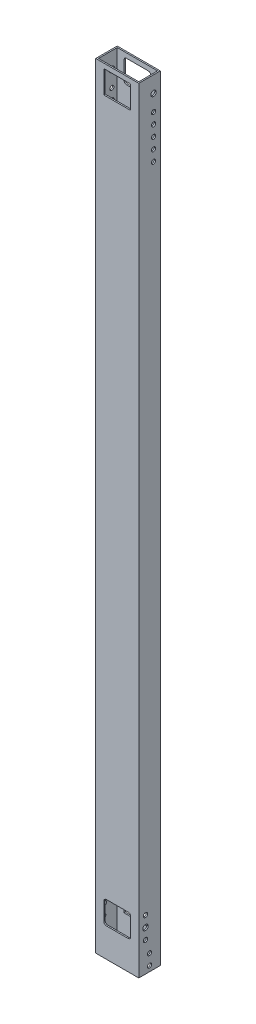
from build123d import *

# Parameters (mm, degrees)
SKETCH1_W               = 50.8
SKETCH1_H               = 914.4
BOSS_EXTRUDE1_DEPTH     = 12.7
SHELL1_T                = -1.5875
CUT_EXTRUDE1_DEPTH      = 459.081095441
CUT_EXTRUDE1_DEPTH_BACK = 459.081095441
SKETCH3_R               = 2.4892
CUT_EXTRUDE2_DEPTH      = 459.081095441
CUT_EXTRUDE2_DEPTH_BACK = 459.081095441
SKETCH4_R               = 3.175
SKETCH4_R_2             = 2.4892
CUT_EXTRUDE3_DEPTH      = 459.081095441
CUT_EXTRUDE3_DEPTH_BACK = 459.081095441
SKETCH5_W               = 31.75
SKETCH5_H               = 26.9875
FILLET1_R               = 3.175
CUT_EXTRUDE4_DEPTH      = 459.081095441
CUT_EXTRUDE4_DEPTH_BACK = 459.081095441
SKETCH6_R               = 3.175
CUT_EXTRUDE5_DEPTH      = 459.081095441
CUT_EXTRUDE5_DEPTH_BACK = 459.081095441
SKETCH7_W               = 31.75
SKETCH7_H               = 26.9875
FILLET2_R               = 3.175
CUT_EXTRUDE6_DEPTH      = 459.081095441
CUT_EXTRUDE6_DEPTH_BACK = 459.081095441
SKETCH8_R               = 2.4892


with BuildPart() as part:
    # Sketch1 → Boss-Extrude1 (new, symmetric)
    with BuildSketch(Plane.XY):
        Rectangle(SKETCH1_W, SKETCH1_H)
    extrude(amount=BOSS_EXTRUDE1_DEPTH, both=True)

    # Shell1
    shell1_openings = [part.faces().sort_by_distance(p)[0] for p in [
        (0, -457.2, 0),
        (0, 457.2, 0),
    ]]
    offset(amount=SHELL1_T, openings=shell1_openings, kind=Kind.INTERSECTION)

    # Sketch3 → Cut-Extrude1 (cut, two sides: drawn at the far end of the back side and taken through both)
    with BuildSketch(Plane(origin=(0, 0, 0), x_dir=(0, 0, -1), z_dir=(1, 0, 0)).offset(-CUT_EXTRUDE1_DEPTH_BACK)):
        with Locations((0, -450.85)):
            Circle(SKETCH3_R)
        with Locations((0, -438.15)):
            Circle(SKETCH3_R)
    extrude(amount=CUT_EXTRUDE1_DEPTH + CUT_EXTRUDE1_DEPTH_BACK, mode=Mode.SUBTRACT)

    # Sketch4 → Cut-Extrude2 (cut, two sides: drawn at the far end of the back side and taken through both)
    with BuildSketch(Plane(origin=(0, 0, 0), x_dir=(0, 0, -1), z_dir=(1, 0, 0)).offset(-CUT_EXTRUDE2_DEPTH_BACK)):
        with Locations((-4.7625, -409.575)):
            Circle(SKETCH4_R)
        with Locations((-4.7625, -396.875)):
            Circle(SKETCH4_R_2)
        with Locations((-4.7625, -422.275)):
            Circle(SKETCH4_R_2)
    extrude(amount=CUT_EXTRUDE2_DEPTH + CUT_EXTRUDE2_DEPTH_BACK, mode=Mode.SUBTRACT)

    # Sketch5 → Cut-Extrude3 (cut, two sides: drawn at the far end of the back side and taken through both)
    with BuildSketch(Plane.XY.offset(-CUT_EXTRUDE3_DEPTH_BACK)):
        with Locations((0, -409.575)):
            Rectangle(SKETCH5_W, SKETCH5_H)
    extrude(amount=CUT_EXTRUDE3_DEPTH + CUT_EXTRUDE3_DEPTH_BACK, mode=Mode.SUBTRACT)

    # Fillet1
    fillet1_edges = [part.edges().sort_by_distance(p)[0] for p in [
        (-15.875, -423.06875, 11.90625),
        (15.875, -423.06875, 11.90625),
        (-15.875, -396.08125, 11.90625),
        (15.875, -396.08125, 11.90625),
    ]]
    fillet(fillet1_edges, radius=FILLET1_R)

    # Sketch6 → Cut-Extrude4 (cut, two sides: drawn at the far end of the back side and taken through both)
    with BuildSketch(Plane(origin=(0, 0, 0), x_dir=(0, 0, -1), z_dir=(1, 0, 0)).offset(-CUT_EXTRUDE4_DEPTH_BACK)):
        with Locations((4.7625, 438.15)):
            Circle(SKETCH6_R)
    extrude(amount=CUT_EXTRUDE4_DEPTH + CUT_EXTRUDE4_DEPTH_BACK, mode=Mode.SUBTRACT)

    # Sketch7 → Cut-Extrude5 (cut, two sides: drawn at the far end of the back side and taken through both)
    with BuildSketch(Plane.XY.offset(-CUT_EXTRUDE5_DEPTH_BACK)):
        with Locations((0, 438.15)):
            Rectangle(SKETCH7_W, SKETCH7_H)
    extrude(amount=CUT_EXTRUDE5_DEPTH + CUT_EXTRUDE5_DEPTH_BACK, mode=Mode.SUBTRACT)

    # Fillet2
    fillet2_edges = [part.edges().sort_by_distance(p)[0] for p in [
        (15.875, 424.65625, -11.90625),
        (-15.875, 424.65625, -11.90625),
        (-15.875, 451.64375, -11.90625),
        (15.875, 451.64375, -11.90625),
    ]]
    fillet(fillet2_edges, radius=FILLET2_R)

    # Sketch8 → Cut-Extrude6 (cut, two sides: drawn at the far end of the back side and taken through both)
    with BuildSketch(Plane(origin=(0, 0, 0), x_dir=(0, 0, -1), z_dir=(1, 0, 0)).offset(-CUT_EXTRUDE6_DEPTH_BACK)):
        with Locations((4.7625, 419.1)):
            Circle(SKETCH8_R)
        with Locations((4.7625, 406.4)):
            Circle(SKETCH8_R)
        with Locations((4.7625, 393.7)):
            Circle(SKETCH8_R)
        with Locations((4.7625, 381)):
            Circle(SKETCH8_R)
        with Locations((4.7625, 368.3)):
            Circle(SKETCH8_R)
    extrude(amount=CUT_EXTRUDE6_DEPTH + CUT_EXTRUDE6_DEPTH_BACK, mode=Mode.SUBTRACT)


solid = part.part
